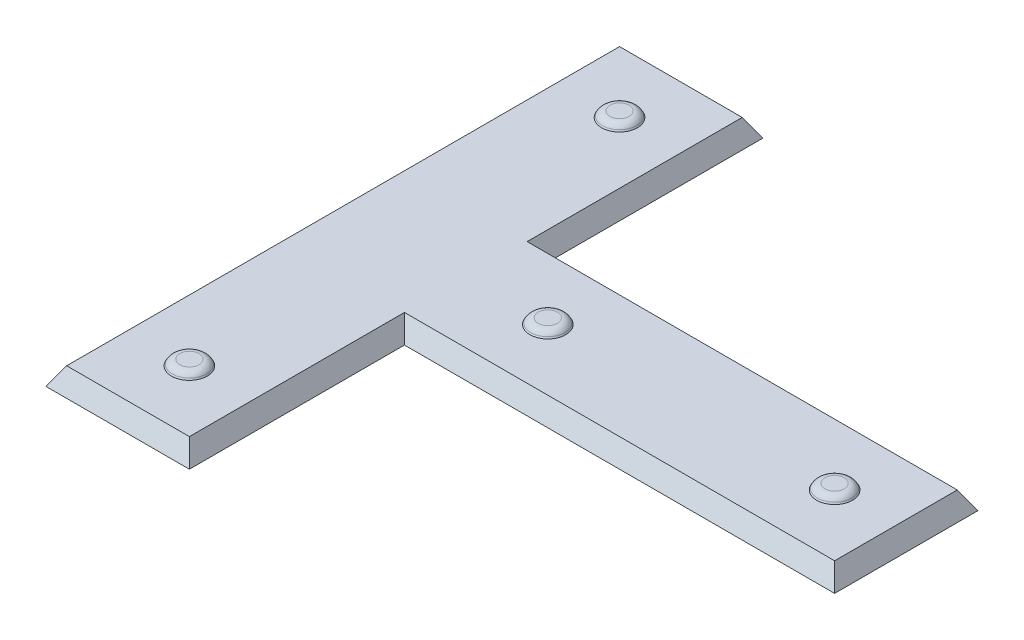
from build123d import *

# Parameters (mm, degrees)
BOSS_EXTRUDE1_DEPTH           = 0.79375
BOSS_EXTRUDE1_TAPER           = 30
SKETCH3_R                     = 0.79375
BOSS_EXTRUDE2_DEPTH           = 0.254
BOSS_EXTRUDE2_DRAFT           = 30
BOSS_EXTRUDE2_PROFILE_2_DEPTH = 0.254
BOSS_EXTRUDE2_PROFILE_2_DRAFT = 30
BOSS_EXTRUDE2_PROFILE_3_DEPTH = 0.254
BOSS_EXTRUDE2_PROFILE_3_DRAFT = 30
BOSS_EXTRUDE2_PROFILE_4_DEPTH = 0.254
BOSS_EXTRUDE2_PROFILE_4_DRAFT = 30
FILLET1_R                     = 0.381


with BuildPart() as part:
    # Sketch2 → Boss-Extrude1 (new body)
    with BuildSketch(Plane(origin=(0, 15.875, 0), x_dir=(1, 0, 0), z_dir=(0, 1, 0))):
        Polygon((-169.8625, 42.8625), (-169.8625, 17.4625), (-163.5125, 17.4625), (-163.5125, 26.9875), (-144.4625, 26.9875), (-144.4625, 33.3375), (-163.5125, 33.3375), (-163.5125, 42.8625), align=None)
    extrude(amount=BOSS_EXTRUDE1_DEPTH, taper=BOSS_EXTRUDE1_TAPER)


with BuildPart() as boss_extrude2_tool:
    # Sketch3 → Boss-Extrude2 (with draft: the straight prism first)
    with BuildSketch(Plane(origin=(0, 16.66875, 0), x_dir=(1, 0, 0), z_dir=(0, 1, 0))):
        with Locations((-147.6375, 30.1625)):
            Circle(SKETCH3_R)
    extrude(amount=BOSS_EXTRUDE2_DEPTH)
    # Boss-Extrude2: the draft: its side faces are tilted about the plane it starts from
    boss_extrude2_sides = [boss_extrude2_tool.faces().sort_by_distance(p)[0] for p in [
        (-148.43125, 16.79575, -30.1625),
    ]]
    draft(boss_extrude2_sides, Plane(origin=(0, 16.66875, 0), x_dir=(1, 0, 0), z_dir=(0, 1, 0)), BOSS_EXTRUDE2_DRAFT)


with BuildPart() as part_1:
    add(part.part)

    # Boss-Extrude2: add boss_extrude2_tool
    add(boss_extrude2_tool.part)


with BuildPart() as boss_extrude2_profile_2_tool:
    # Sketch3 → Boss-Extrude2 profile 2 (with draft: the straight prism first)
    with BuildSketch(Plane(origin=(0, 16.66875, 0), x_dir=(1, 0, 0), z_dir=(0, 1, 0))):
        with Locations((-160.3375, 30.1625)):
            Circle(SKETCH3_R)
    extrude(amount=BOSS_EXTRUDE2_PROFILE_2_DEPTH)
    # Boss-Extrude2 profile 2: the draft: its side faces are tilted about the plane it starts from
    boss_extrude2_profile_2_sides = [boss_extrude2_profile_2_tool.faces().sort_by_distance(p)[0] for p in [
        (-161.13125, 16.79575, -30.1625),
    ]]
    draft(boss_extrude2_profile_2_sides, Plane(origin=(0, 16.66875, 0), x_dir=(1, 0, 0), z_dir=(0, 1, 0)), BOSS_EXTRUDE2_PROFILE_2_DRAFT)


with BuildPart() as part_2:
    add(part_1.part)

    # Boss-Extrude2 profile 2: add boss_extrude2_profile_2_tool
    add(boss_extrude2_profile_2_tool.part)


with BuildPart() as boss_extrude2_profile_3_tool:
    # Sketch3 → Boss-Extrude2 profile 3 (with draft: the straight prism first)
    with BuildSketch(Plane(origin=(0, 16.66875, 0), x_dir=(1, 0, 0), z_dir=(0, 1, 0))):
        with Locations((-166.6875, 39.6875)):
            Circle(SKETCH3_R)
    extrude(amount=BOSS_EXTRUDE2_PROFILE_3_DEPTH)
    # Boss-Extrude2 profile 3: the draft: its side faces are tilted about the plane it starts from
    boss_extrude2_profile_3_sides = [boss_extrude2_profile_3_tool.faces().sort_by_distance(p)[0] for p in [
        (-167.48125, 16.79575, -39.6875),
    ]]
    draft(boss_extrude2_profile_3_sides, Plane(origin=(0, 16.66875, 0), x_dir=(1, 0, 0), z_dir=(0, 1, 0)), BOSS_EXTRUDE2_PROFILE_3_DRAFT)


with BuildPart() as part_3:
    add(part_2.part)

    # Boss-Extrude2 profile 3: add boss_extrude2_profile_3_tool
    add(boss_extrude2_profile_3_tool.part)


with BuildPart() as boss_extrude2_profile_4_tool:
    # Sketch3 → Boss-Extrude2 profile 4 (with draft: the straight prism first)
    with BuildSketch(Plane(origin=(0, 16.66875, 0), x_dir=(1, 0, 0), z_dir=(0, 1, 0))):
        with Locations((-166.6875, 20.6375)):
            Circle(SKETCH3_R)
    extrude(amount=BOSS_EXTRUDE2_PROFILE_4_DEPTH)
    # Boss-Extrude2 profile 4: the draft: its side faces are tilted about the plane it starts from
    boss_extrude2_profile_4_sides = [boss_extrude2_profile_4_tool.faces().sort_by_distance(p)[0] for p in [
        (-167.48125, 16.79575, -20.6375),
    ]]
    draft(boss_extrude2_profile_4_sides, Plane(origin=(0, 16.66875, 0), x_dir=(1, 0, 0), z_dir=(0, 1, 0)), BOSS_EXTRUDE2_PROFILE_4_DRAFT)


with BuildPart() as part_4:
    add(part_3.part)

    # Boss-Extrude2 profile 4: add boss_extrude2_profile_4_tool
    add(boss_extrude2_profile_4_tool.part)

    # Fillet1
    fillet1_edges = [part_4.edges().sort_by_distance(p)[0] for p in [
        (-148.284603032, 16.92275, -30.1625),
        (-160.984603032, 16.92275, -30.1625),
        (-167.334603032, 16.92275, -39.6875),
        (-167.334603032, 16.92275, -20.6375),
    ]]
    fillet(fillet1_edges, radius=FILLET1_R)


solid = part_4.part
